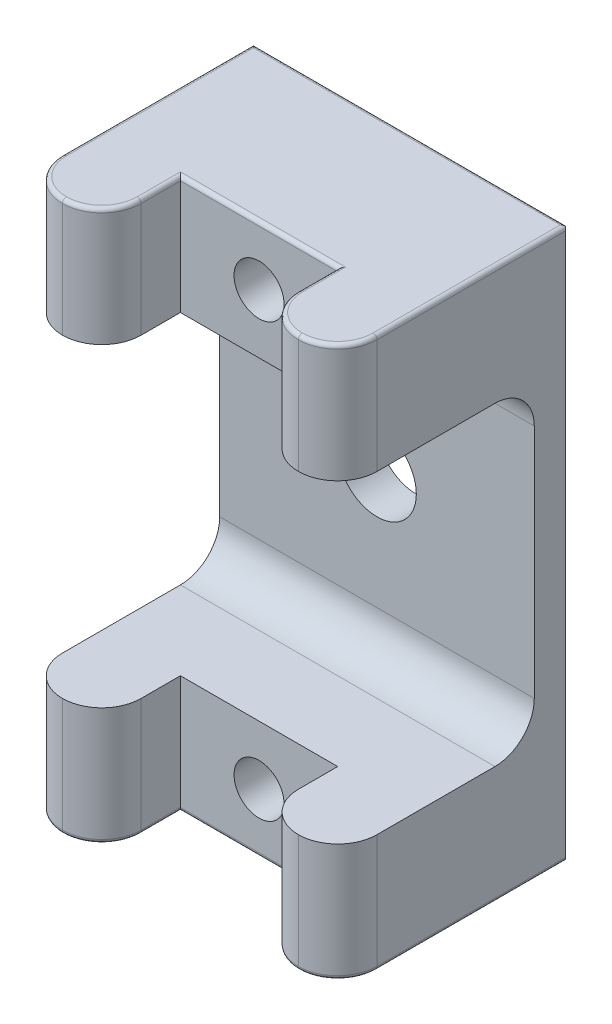
from build123d import *

# Parameters (mm, degrees)
SKETCH1_W                       = 25.4
SKETCH1_H                       = 19.05
BOSS_EXTRUDE1_DEPTH             = 44.45
SKETCH2_W                       = 25.4
SKETCH2_H                       = 15.875
CUT_EXTRUDE4_DEPTH              = 38.162422217
SKETCH3_W                       = 12.7
SKETCH3_H                       = 6.35
CUT_EXTRUDE5_DEPTH              = 50.8
FILLET1_R                       = 3.175
F_10_32_TAPPED_HOLE1_D          = 4.0386
F_10_32_TAPPED_HOLE1_DEPTH      = 5.334
F_10_32_TAPPED_HOLE1_TIP        = 1.213317848
CHAMFER1_SIZE                   = 0.635
F_1_4_0_25_DIAMETER_HOLE1_D     = 6.35
F_1_4_0_25_DIAMETER_HOLE1_DEPTH = 31.242
F_1_4_0_25_DIAMETER_HOLE1_TIP   = 1.907732465
FILLET2_R                       = 0.3175
FILLET3_R                       = 3.175


# Some blends are built 0.0001 mm under size
with BuildPart() as part:
    # Sketch1 → Boss-Extrude1 (new body)
    with BuildSketch(Plane(origin=(0, 0, 0), x_dir=(1, 0, 0), z_dir=(0, 1, 0))):
        Rectangle(SKETCH1_W, SKETCH1_H)
    extrude(amount=BOSS_EXTRUDE1_DEPTH)

    # Sketch2 → Cut-Extrude4 (cut, through all)
    with BuildSketch(Plane(origin=(12.7, 25.4, 0), x_dir=(0, 1, 0), z_dir=(-1, 0, 0))):
        with Locations((-3.175, -1.5875)):
            Rectangle(SKETCH2_W, SKETCH2_H)
    extrude(amount=CUT_EXTRUDE4_DEPTH, mode=Mode.SUBTRACT)

    # Sketch3 → Cut-Extrude5 (cut)
    with BuildSketch(Plane(origin=(0, 44.45, 0), x_dir=(1, 0, 0), z_dir=(0, 1, 0))):
        with Locations((0, -6.35)):
            Rectangle(SKETCH3_W, SKETCH3_H)
    extrude(amount=-CUT_EXTRUDE5_DEPTH, mode=Mode.SUBTRACT)

    # Fillet1
    fillet1_edges = [part.edges().sort_by_distance(p)[0] for p in [
        (-12.7, 39.6875, 9.525),
        (-12.7, 4.7625, 9.525),
        (-6.35, 4.7625, 9.525),
        (12.7, 4.7625, 9.525),
        (6.35, 4.7625, 9.525),
        (12.7, 39.6875, 9.525),
        (6.35, 39.6875, 9.525),
        (-6.35, 39.6875, 9.525),
    ]]
    fillet(fillet1_edges, radius=FILLET1_R - 0.0001)  # a hair under: the kernel refuses the full size

    # #10-32 Tapped Hole1
    with Locations(Plane.XY.offset(3.175)):
        with Locations((0, 39.6875), (0, 4.7625)):
            Hole(F_10_32_TAPPED_HOLE1_D / 2, depth=F_10_32_TAPPED_HOLE1_DEPTH)
            with Locations((0, 0, -(F_10_32_TAPPED_HOLE1_DEPTH + F_10_32_TAPPED_HOLE1_TIP / 2))):  # 118° drill point
                Cone(0, F_10_32_TAPPED_HOLE1_D / 2, F_10_32_TAPPED_HOLE1_TIP, mode=Mode.SUBTRACT)

    # Chamfer1
    chamfer1_edges = [part.edges().sort_by_distance(p)[0] for p in [
        (0, 0, -9.525),
        (0, 44.45, -9.525),
        (-12.7, 22.225, -9.525),
        (12.7, 22.225, -9.525),
    ]]
    chamfer(chamfer1_edges, length=CHAMFER1_SIZE)

    # 1/4 (0.25) Diameter Hole1
    with Locations(Plane.XY.offset(-6.35)):
        with Locations((0, 22.225)):
            Hole(F_1_4_0_25_DIAMETER_HOLE1_D / 2, depth=F_1_4_0_25_DIAMETER_HOLE1_DEPTH)
            with Locations((0, 0, -(F_1_4_0_25_DIAMETER_HOLE1_DEPTH + F_1_4_0_25_DIAMETER_HOLE1_TIP / 2))):  # 118° drill point
                Cone(0, F_1_4_0_25_DIAMETER_HOLE1_D / 2, F_1_4_0_25_DIAMETER_HOLE1_TIP, mode=Mode.SUBTRACT)

    # Fillet2
    # the kernel refuses this fillet: 0.3175 mm, written as the material it takes off along each edge
    with BuildSketch(Plane(origin=(-12.7, 44.45, 6.3501), x_dir=(0, -1, 0), z_dir=(0, 0, -1)), Plane(origin=(12.7, 0, -9.68375), x_dir=(-1, 0, 0), z_dir=(0, 0, 1))) as fillet2_piece_1:
        with BuildLine():
            CenterArc((FILLET2_R, -FILLET2_R), FILLET2_R, 90, 90)
            Line((0, -FILLET2_R), (0, 0))
            Line((0, 0), (FILLET2_R, 0))
        make_face()
    extrude(amount=16.03385, mode=Mode.SUBTRACT)
    with BuildSketch(Plane(origin=(-13.028782015, 44.45, -8.89), x_dir=(0, 0, 1), z_dir=(1, 0, 0))) as fillet2_piece_2:
        with BuildLine():
            CenterArc((FILLET2_R * 0.414213562373, FILLET2_R), FILLET2_R, 225, 45)
            Line((-FILLET2_R * 0.292893218813, FILLET2_R * 0.292893218813), (0, 0))
            Line((0, 0), (FILLET2_R * 0.414213562373, 0))
        make_face()
    extrude(amount=26.05756403, mode=Mode.SUBTRACT)
    with BuildSketch(Plane(origin=(-12.7, 0, 6.3501), x_dir=(0, 1, 0), z_dir=(0, 0, -1)), Plane(origin=(12.7, 44.45, -9.68375), x_dir=(-1, 0, 0), z_dir=(0, 0, 1))) as fillet2_piece_3:
        with BuildLine():
            CenterArc((FILLET2_R, FILLET2_R), FILLET2_R, 180, 90)
            Line((0, FILLET2_R), (0, 0))
            Line((0, 0), (FILLET2_R, 0))
        make_face()
    extrude(amount=16.03385, mode=Mode.SUBTRACT)
    with BuildSketch(Plane(origin=(-13.028782015, 0, -8.89), x_dir=(0, 0, 1), z_dir=(1, 0, 0))) as fillet2_piece_4:
        with BuildLine():
            CenterArc((FILLET2_R * 0.414213562373, -FILLET2_R), FILLET2_R, 90, 45)
            Line((-FILLET2_R * 0.292893218813, -FILLET2_R * 0.292893218813), (0, 0))
            Line((0, 0), (FILLET2_R * 0.414213562373, 0))
        make_face()
    extrude(amount=26.05756403, mode=Mode.SUBTRACT)
    with BuildSketch(Plane(origin=(-6.35, 0, 6.3501), x_dir=(-1, 0, 0), z_dir=(0, 0, -1)), Plane(origin=(-6.35, 44.45, 3.175), x_dir=(-1, 0, 0), z_dir=(0, 0, 1)), Plane(origin=(6.35, 0, 3.175), x_dir=(1, 0, 0), z_dir=(0, 0, 1)), Plane(origin=(6.35, 44.45, 6.3501), x_dir=(1, 0, 0), z_dir=(0, 0, -1))) as fillet2_piece_5:
        with BuildLine():
            CenterArc((FILLET2_R, FILLET2_R), FILLET2_R, 180, 90)
            Line((0, FILLET2_R), (0, 0))
            Line((0, 0), (FILLET2_R, 0))
        make_face()
    extrude(amount=3.1751, mode=Mode.SUBTRACT)
    with BuildSketch(Plane(origin=(-6.35, 0, 3.175), x_dir=(0, 0, -1), z_dir=(1, 0, 0)), Plane(origin=(6.35, 44.45, 3.175), x_dir=(0, 0, -1), z_dir=(-1, 0, 0))) as fillet2_piece_6:
        with BuildLine():
            CenterArc((FILLET2_R, FILLET2_R), FILLET2_R, 180, 90)
            Line((0, FILLET2_R), (0, 0))
            Line((0, 0), (FILLET2_R, 0))
        make_face()
    extrude(amount=12.7, mode=Mode.SUBTRACT)
    with BuildSketch(Plane(origin=(9.5249, 0, 6.3501), x_dir=(0, 0, 1), z_dir=(1, 0, 0))) as fillet2_piece_7:
        with BuildLine():
            CenterArc((3.1749 - FILLET2_R, -FILLET2_R), FILLET2_R, 360, 90)
            Line((3.1749, -FILLET2_R), (3.1749, 0))
            Line((3.1749, 0), (3.1749 - FILLET2_R, 0))
        make_face()
    revolve(axis=Axis((9.5249, 0, 6.3501), (0, -1, 0)), revolution_arc=90, mode=Mode.SUBTRACT)
    with BuildSketch(Plane(origin=(9.5251, 0, 6.3501), x_dir=(1, 0, 0), z_dir=(0, 0, -1))) as fillet2_piece_8:
        with BuildLine():
            CenterArc((3.1749 - FILLET2_R, -FILLET2_R), FILLET2_R, 0, 90)
            Line((3.1749, -FILLET2_R), (3.1749, 0))
            Line((3.1749, 0), (3.1749 - FILLET2_R, 0))
        make_face()
    revolve(axis=Axis((9.5251, 0, 6.3501), (0, -1, 0)), revolution_arc=90, mode=Mode.SUBTRACT)
    with BuildSketch(Plane(origin=(-9.5249, 0, 6.3501), x_dir=(0, 0, 1), z_dir=(-1, 0, 0))) as fillet2_piece_9:
        with BuildLine():
            CenterArc((3.1749 - FILLET2_R, FILLET2_R), FILLET2_R, 270, 90)
            Line((3.1749, FILLET2_R), (3.1749, 0))
            Line((3.1749, 0), (3.1749 - FILLET2_R, 0))
        make_face()
    revolve(axis=Axis((-9.5249, 0, 6.3501), (0, 1, 0)), revolution_arc=90, mode=Mode.SUBTRACT)
    with BuildSketch(Plane(origin=(-9.5251, 0, 6.3501), x_dir=(-1, 0, 0), z_dir=(0, 0, -1))) as fillet2_piece_10:
        with BuildLine():
            CenterArc((3.1749 - FILLET2_R, FILLET2_R), FILLET2_R, 270, 90)
            Line((3.1749, FILLET2_R), (3.1749, 0))
            Line((3.1749, 0), (3.1749 - FILLET2_R, 0))
        make_face()
    revolve(axis=Axis((-9.5251, 0, 6.3501), (0, 1, 0)), revolution_arc=90, mode=Mode.SUBTRACT)
    with BuildSketch(Plane(origin=(-9.5251, 44.45, 6.3501), x_dir=(-1, 0, 0), z_dir=(0, 0, -1))) as fillet2_piece_11:
        with BuildLine():
            CenterArc((3.1749 - FILLET2_R, -FILLET2_R), FILLET2_R, 0, 90)
            Line((3.1749, -FILLET2_R), (3.1749, 0))
            Line((3.1749, 0), (3.1749 - FILLET2_R, 0))
        make_face()
    revolve(axis=Axis((-9.5251, 44.45, 6.3501), (0, 1, 0)), revolution_arc=90, mode=Mode.SUBTRACT)
    with BuildSketch(Plane(origin=(-9.5249, 44.45, 6.3501), x_dir=(0, 0, 1), z_dir=(-1, 0, 0))) as fillet2_piece_12:
        with BuildLine():
            CenterArc((3.1749 - FILLET2_R, -FILLET2_R), FILLET2_R, 0, 90)
            Line((3.1749, -FILLET2_R), (3.1749, 0))
            Line((3.1749, 0), (3.1749 - FILLET2_R, 0))
        make_face()
    revolve(axis=Axis((-9.5249, 44.45, 6.3501), (0, 1, 0)), revolution_arc=90, mode=Mode.SUBTRACT)
    with BuildSketch(Plane(origin=(9.5249, 44.45, 6.3501), x_dir=(0, 0, 1), z_dir=(1, 0, 0))) as fillet2_piece_13:
        with BuildLine():
            CenterArc((3.1749 - FILLET2_R, FILLET2_R), FILLET2_R, 270, 90)
            Line((3.1749, FILLET2_R), (3.1749, 0))
            Line((3.1749, 0), (3.1749 - FILLET2_R, 0))
        make_face()
    revolve(axis=Axis((9.5249, 44.45, 6.3501), (0, -1, 0)), revolution_arc=90, mode=Mode.SUBTRACT)
    with BuildSketch(Plane(origin=(9.5251, 44.45, 6.3501), x_dir=(1, 0, 0), z_dir=(0, 0, -1))) as fillet2_piece_14:
        with BuildLine():
            CenterArc((3.1749 - FILLET2_R, FILLET2_R), FILLET2_R, 270, 90)
            Line((3.1749, FILLET2_R), (3.1749, 0))
            Line((3.1749, 0), (3.1749 - FILLET2_R, 0))
        make_face()
    revolve(axis=Axis((9.5251, 44.45, 6.3501), (0, -1, 0)), revolution_arc=90, mode=Mode.SUBTRACT)
    with BuildSketch(Plane(origin=(9.5251, 44.45, 9.525), x_dir=(0, 0, -1), z_dir=(-1, 0, 0)), Plane(origin=(-9.5249, 44.45, 9.525), x_dir=(0, 0, -1), z_dir=(-1, 0, 0))) as fillet2_piece_15:
        with BuildLine():
            CenterArc((FILLET2_R, FILLET2_R), FILLET2_R, 180, 90)
            Line((0, FILLET2_R), (0, 0))
            Line((0, 0), (FILLET2_R, 0))
        make_face()
    extrude(amount=0.0002, mode=Mode.SUBTRACT)
    with BuildSketch(Plane(origin=(-9.5249, 0, 9.525), x_dir=(0, 0, -1), z_dir=(-1, 0, 0)), Plane(origin=(9.5251, 0, 9.525), x_dir=(0, 0, -1), z_dir=(-1, 0, 0))) as fillet2_piece_16:
        with BuildLine():
            CenterArc((FILLET2_R, -FILLET2_R), FILLET2_R, 90, 90)
            Line((0, -FILLET2_R), (0, 0))
            Line((0, 0), (FILLET2_R, 0))
        make_face()
    extrude(amount=0.0002, mode=Mode.SUBTRACT)
    with BuildSketch(Plane(origin=(-6.35, 0, 6.3501), x_dir=(-1, 0, 0), z_dir=(0, 0, -1))) as fillet2_piece_17a_section:
        with BuildLine():
            CenterArc((FILLET2_R, FILLET2_R), FILLET2_R, 180, 90)
            Line((0, FILLET2_R), (0, 0))
            Line((0, 0), (FILLET2_R, 0))
        make_face()
    fillet2_piece_17a = extrude(amount=3.96885, mode=Mode.PRIVATE)
    fillet2_piece_17a = split(fillet2_piece_17a, bisect_by=Plane(origin=(-6.421880449, 0.071880449, 3.175), z_dir=(0, 0, -1)), keep=Keep.TOP, mode=Mode.PRIVATE)
    with BuildSketch(Plane(origin=(-7.14375, 0, 3.175), x_dir=(0, 0, -1), z_dir=(1, 0, 0))) as fillet2_piece_17b_section:
        with BuildLine():
            CenterArc((FILLET2_R, FILLET2_R), FILLET2_R, 180, 90)
            Line((0, FILLET2_R), (0, 0))
            Line((0, 0), (FILLET2_R, 0))
        make_face()
    fillet2_piece_17b = extrude(amount=13.49375, mode=Mode.PRIVATE)
    fillet2_piece_17b = split(fillet2_piece_17b, bisect_by=Plane(origin=(-6.35, 0.071880449, 3.103119551), z_dir=(-1, 0, 0)), keep=Keep.TOP, mode=Mode.PRIVATE)
    fillet2_piece_17 = fillet2_piece_17a & fillet2_piece_17b
    add(fillet2_piece_17, mode=Mode.SUBTRACT)
    with BuildSketch(Plane(origin=(-6.35, 0, 3.175), x_dir=(0, 0, -1), z_dir=(1, 0, 0))) as fillet2_piece_18a_section:
        with BuildLine():
            CenterArc((FILLET2_R, FILLET2_R), FILLET2_R, 180, 90)
            Line((0, FILLET2_R), (0, 0))
            Line((0, 0), (FILLET2_R, 0))
        make_face()
    fillet2_piece_18a = extrude(amount=13.49375, mode=Mode.PRIVATE)
    fillet2_piece_18a = split(fillet2_piece_18a, bisect_by=Plane(origin=(6.35, 0.071880449, 3.103119551), z_dir=(1, 0, 0)), keep=Keep.TOP, mode=Mode.PRIVATE)
    with BuildSketch(Plane(origin=(6.35, 0, 2.38125), x_dir=(1, 0, 0), z_dir=(0, 0, 1))) as fillet2_piece_18b_section:
        with BuildLine():
            CenterArc((FILLET2_R, FILLET2_R), FILLET2_R, 180, 90)
            Line((0, FILLET2_R), (0, 0))
            Line((0, 0), (FILLET2_R, 0))
        make_face()
    fillet2_piece_18b = extrude(amount=3.96885, mode=Mode.PRIVATE)
    fillet2_piece_18b = split(fillet2_piece_18b, bisect_by=Plane(origin=(6.421880449, 0.071880449, 3.175), z_dir=(0, 0, -1)), keep=Keep.TOP, mode=Mode.PRIVATE)
    fillet2_piece_18 = fillet2_piece_18a & fillet2_piece_18b
    add(fillet2_piece_18, mode=Mode.SUBTRACT)
    with BuildSketch(Plane(origin=(-6.35, 44.45, 2.38125), x_dir=(-1, 0, 0), z_dir=(0, 0, 1))) as fillet2_piece_19a_section:
        with BuildLine():
            CenterArc((FILLET2_R, FILLET2_R), FILLET2_R, 180, 90)
            Line((0, FILLET2_R), (0, 0))
            Line((0, 0), (FILLET2_R, 0))
        make_face()
    fillet2_piece_19a = extrude(amount=3.96885, mode=Mode.PRIVATE)
    fillet2_piece_19a = split(fillet2_piece_19a, bisect_by=Plane(origin=(-6.421880449, 44.378119551, 3.175), z_dir=(0, 0, -1)), keep=Keep.TOP, mode=Mode.PRIVATE)
    with BuildSketch(Plane(origin=(6.35, 44.45, 3.175), x_dir=(0, 0, -1), z_dir=(-1, 0, 0))) as fillet2_piece_19b_section:
        with BuildLine():
            CenterArc((FILLET2_R, FILLET2_R), FILLET2_R, 180, 90)
            Line((0, FILLET2_R), (0, 0))
            Line((0, 0), (FILLET2_R, 0))
        make_face()
    fillet2_piece_19b = extrude(amount=13.49375, mode=Mode.PRIVATE)
    fillet2_piece_19b = split(fillet2_piece_19b, bisect_by=Plane(origin=(-6.35, 44.378119551, 3.103119551), z_dir=(-1, 0, 0)), keep=Keep.TOP, mode=Mode.PRIVATE)
    fillet2_piece_19 = fillet2_piece_19a & fillet2_piece_19b
    add(fillet2_piece_19, mode=Mode.SUBTRACT)
    with BuildSketch(Plane(origin=(7.14375, 44.45, 3.175), x_dir=(0, 0, -1), z_dir=(-1, 0, 0))) as fillet2_piece_20a_section:
        with BuildLine():
            CenterArc((FILLET2_R, FILLET2_R), FILLET2_R, 180, 90)
            Line((0, FILLET2_R), (0, 0))
            Line((0, 0), (FILLET2_R, 0))
        make_face()
    fillet2_piece_20a = extrude(amount=13.49375, mode=Mode.PRIVATE)
    fillet2_piece_20a = split(fillet2_piece_20a, bisect_by=Plane(origin=(6.35, 44.378119551, 3.103119551), z_dir=(1, 0, 0)), keep=Keep.TOP, mode=Mode.PRIVATE)
    with BuildSketch(Plane(origin=(6.35, 44.45, 6.3501), x_dir=(1, 0, 0), z_dir=(0, 0, -1))) as fillet2_piece_20b_section:
        with BuildLine():
            CenterArc((FILLET2_R, FILLET2_R), FILLET2_R, 180, 90)
            Line((0, FILLET2_R), (0, 0))
            Line((0, 0), (FILLET2_R, 0))
        make_face()
    fillet2_piece_20b = extrude(amount=3.96885, mode=Mode.PRIVATE)
    fillet2_piece_20b = split(fillet2_piece_20b, bisect_by=Plane(origin=(6.421880449, 44.378119551, 3.175), z_dir=(0, 0, -1)), keep=Keep.TOP, mode=Mode.PRIVATE)
    fillet2_piece_20 = fillet2_piece_20a & fillet2_piece_20b
    add(fillet2_piece_20, mode=Mode.SUBTRACT)

    # Fillet3
    fillet3_edges = [part.edges().sort_by_distance(p)[0] for p in [
        (0, 9.525, -6.35),
        (0, 34.925, -6.35),
    ]]
    fillet(fillet3_edges, radius=FILLET3_R)


solid = part.part
